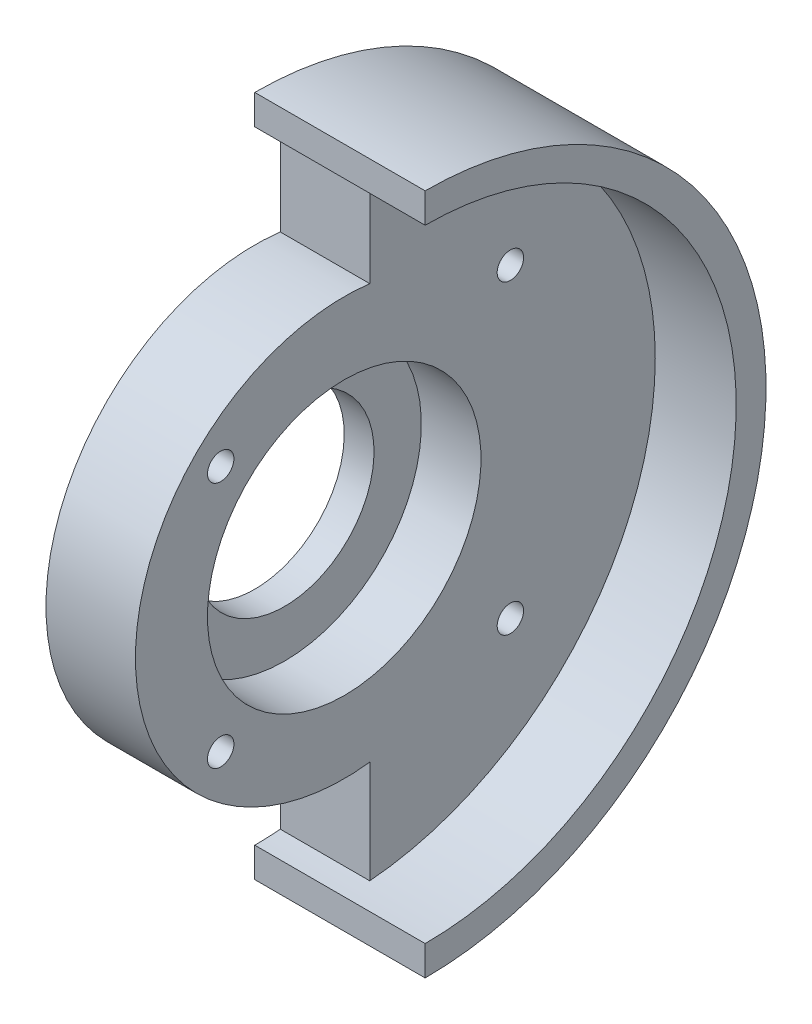
from build123d import *
from build123d.topology import SkipClean

# Parameters (mm, degrees)
CUT_EXTRUDE1_DEPTH      = 58.534772095
CUT_EXTRUDE1_DEPTH_BACK = 58.534772095
SKETCH2_R               = 1.55
SKETCH3_R               = 2.85
CUT_EXTRUDE2_DEPTH      = 5


with BuildPart() as part:
    # Sketch1 → Revolve1 (revolve)
    with BuildSketch(Plane.XY):
        Polygon((20, 40), (20, 36.5), (10.5, 36.5), (10.5, 16.05), (3.5, 16.05), (3.5, 10.5), (0, 10.5), (0, 40), align=None)
    revolve(axis=Axis((20, 0, 0), (-1, 0, 0)))

    # Sketch2 → Cut-Extrude1 (cut, two sides: drawn at the far end of the back side and taken through both)
    with SkipClean():  # the faces are left unmerged after this step: merging them gives an invalid solid
        with BuildSketch(Plane(origin=(10.5, 0, 0), x_dir=(0, 0, -1), z_dir=(1, 0, 0)).offset(-CUT_EXTRUDE1_DEPTH_BACK)):
            with Locations((-14.495689014, 14.495689014)):
                Circle(SKETCH2_R)
            with Locations((19.5, -17.944358445)):
                Circle(SKETCH2_R)
            with Locations((19.5, 17.944358445)):
                Circle(SKETCH2_R)
            with Locations((-14.495689014, -14.495689014)):
                Circle(SKETCH2_R)
            with BuildLine():
                Line((3, 24.315632832), (3, 36.376503405))
                ThreePointArc((3, 36.376503405), (1.501270413, 36.469112783), (0, 36.5))
                Line((0, 36.5), (0, 40))
                ThreePointArc((0, 40), (-40, 0), (0, -40))
                Line((0, -40), (0, -36.5))
                ThreePointArc((0, -36.5), (1.501270413, -36.469112783), (3, -36.376503405))
                Line((3, -36.376503405), (3, -24.315632832))
                ThreePointArc((3, -24.315632832), (-24.5, 0), (3, 24.315632832))
            make_face()
        extrude(amount=CUT_EXTRUDE1_DEPTH + CUT_EXTRUDE1_DEPTH_BACK, mode=Mode.SUBTRACT)

    # Sketch3 → Cut-Extrude2 (cut)
    with SkipClean():  # the faces are left unmerged after this step: merging them gives an invalid solid
        with BuildSketch(Plane.ZY):
            with Locations((-19.5, 17.944358445)):
                Circle(SKETCH3_R)
            with Locations((14.495689014, 14.495689014)):
                Circle(SKETCH3_R)
            with Locations((-19.5, -17.944358445)):
                Circle(SKETCH3_R)
            with Locations((14.495689014, -14.495689014)):
                Circle(SKETCH3_R)
        extrude(amount=-CUT_EXTRUDE2_DEPTH, mode=Mode.SUBTRACT)


solid = part.part
